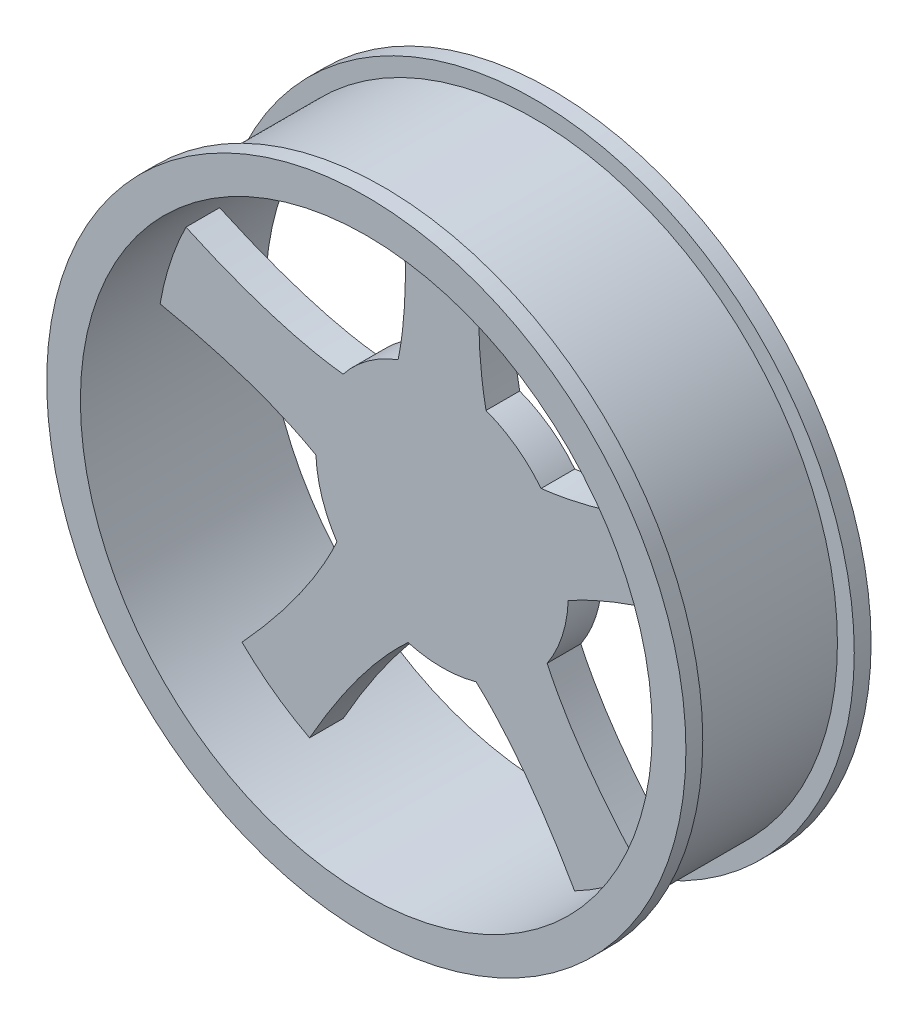
from build123d import *

# Parameters (mm, degrees)
BOSS_EXTRUDE1_DEPTH      = 2
BOSS_EXTRUDE1_DEPTH_BACK = 2
SKETCH3_R                = 15
BOSS_EXTRUDE3_DEPTH      = 2
BOSS_EXTRUDE3_DEPTH_BACK = 2


with BuildPart() as part:
    # Sketch2 → Revolve1 (revolve)
    with BuildSketch(Plane(origin=(0, 0, 0), x_dir=(0, 0, -1), z_dir=(1, 0, 0))):
        Polygon((-9, 35.970899576), (9, 35.970899576), (9, 37.970899576), (11, 37.970899576), (11, 33.970899576), (-11, 33.970899576), (-11, 37.970899576), (-9, 37.970899576), align=None)
    revolve(axis=Axis((0, 0, 10), (0, 0, -1)))



with BuildPart() as body_2:
    # Sketch3 → Boss-Extrude1 (new, two sides: drawn at the far end of the back side and taken through both)
    with BuildSketch(Plane.XY.offset(-BOSS_EXTRUDE1_DEPTH_BACK)):
        Circle(SKETCH3_R)
    extrude(amount=BOSS_EXTRUDE1_DEPTH + BOSS_EXTRUDE1_DEPTH_BACK)


with BuildPart() as part_1:
    add(part.part)

    add(body_2.part)  # Boss-Extrude3 merges body 2
    # Sketch11 → Boss-Extrude3 (add, two sides: drawn at the far end of the back side and taken through both)
    with BuildSketch(Plane.XY.offset(-BOSS_EXTRUDE3_DEPTH_BACK)):
        with BuildLine():
            Line((5, 33.970899576), (-5, 33.970899576))
            add(Edge.make_bspline(
                [(-5, 33.970899576), (-3.602966052, 22.002598894), (-5.219370498, 14.062651656)],
                knots=[0, 0, 0, 0.277878322, 0.277878322, 0.277878322], degree=2))
            add(Edge.make_bspline(
                [(-5.219370498, 14.062651656), (-3.623415853, 14.571458155), (-2.092021841, 14.791258924)],
                knots=[0, 0, 0, 0.220994238, 0.220994238, 0.220994238], degree=2))
            add(Edge.make_bspline(
                [(-2.092021841, 14.791258924), (0.275566205, 15.158843416), (2.712697031, 14.915974307), (5.219370636, 14.062651605)],
                knots=[0.31222072, 0.31222072, 0.31222072, 0.31222072, 0.753229942, 0.753229942, 0.753229942, 0.753229942], degree=3))
            add(Edge.make_bspline(
                [(5, 33.970899576), (3.602966194, 22.002598839), (5.219370636, 14.062651605)],
                knots=[0, 0, 0, 0.277878321, 0.277878321, 0.277878321], degree=2))
        make_face()
        with BuildLine():
            Line((33.853330378, 5.742302702), (30.763160434, 15.252867865))
            add(Edge.make_bspline(
                [(30.763160434, 15.252867865), (19.812337313, 10.225801321), (11.76150231, 9.309514671)],
                knots=[0, 0, 0, 0.277878322, 0.277878322, 0.277878322], degree=2))
            add(Edge.make_bspline(
                [(11.76150231, 9.309514671), (12.738583154, 7.948901461), (13.420852883, 6.56038138)],
                knots=[0, 0, 0, 0.220994238, 0.220994238, 0.220994238], degree=2))
            add(Edge.make_bspline(
                [(13.420852883, 6.56038138), (14.50207145, 4.422261196), (15.024204045, 2.029361361), (14.987250672, -0.618318123)],
                knots=[0.31222072, 0.31222072, 0.31222072, 0.31222072, 0.753229942, 0.753229942, 0.753229942, 0.753229942], degree=3))
            add(Edge.make_bspline(
                [(33.853330378, 5.742302702), (22.039092786, 3.372552484), (14.987250672, -0.618318123)],
                knots=[0, 0, 0, 0.277878321, 0.277878321, 0.277878321], degree=2))
        make_face()
        with BuildLine():
            Line((15.922508806, -30.421961333), (24.01267875, -24.54410881))
            add(Edge.make_bspline(
                [(24.01267875, -24.54410881), (15.847663908, -15.682706115), (12.488378684, -8.309055171)],
                knots=[0, 0, 0, 0.277878322, 0.277878322, 0.277878322], degree=2))
            add(Edge.make_bspline(
                [(12.488378684, -8.309055171), (11.496293211, -9.658766879), (10.386565081, -10.736720252)],
                knots=[0, 0, 0, 0.220994238, 0.220994238, 0.220994238], degree=2))
            add(Edge.make_bspline(
                [(10.386565081, -10.736720252), (8.687206859, -12.42573569), (6.572771723, -13.661760011), (4.043259677, -14.444793221)],
                knots=[0.31222072, 0.31222072, 0.31222072, 0.31222072, 0.753229942, 0.753229942, 0.753229942, 0.753229942], degree=3))
            add(Edge.make_bspline(
                [(15.922508806, -30.421961333), (10.017942228, -19.918246775), (4.043259677, -14.444793221)],
                knots=[0, 0, 0, 0.277878321, 0.277878321, 0.277878321], degree=2))
        make_face()
        with BuildLine():
            Line((-24.01267875, -24.54410881), (-15.922508806, -30.421961333))
            add(Edge.make_bspline(
                [(-15.922508806, -30.421961333), (-10.017942375, -19.918246736), (-4.043259819, -14.444793181)],
                knots=[0, 0, 0, 0.277878322, 0.277878322, 0.277878322], degree=2))
            add(Edge.make_bspline(
                [(-4.043259819, -14.444793181), (-5.633483205, -13.918347682), (-7.001602636, -13.196039424)],
                knots=[0, 0, 0, 0.220994238, 0.220994238, 0.220994238], degree=2))
            add(Edge.make_bspline(
                [(-7.001602636, -13.196039424), (-9.133082344, -12.101788187), (-10.96200772, -10.472793393), (-12.488378766, -8.309055048)],
                knots=[0.31222072, 0.31222072, 0.31222072, 0.31222072, 0.753229942, 0.753229942, 0.753229942, 0.753229942], degree=3))
            add(Edge.make_bspline(
                [(-24.01267875, -24.54410881), (-15.847663991, -15.682705988), (-12.488378766, -8.309055048)],
                knots=[0, 0, 0, 0.277878321, 0.277878321, 0.277878321], degree=2))
        make_face()
        with BuildLine():
            Line((-30.763160434, 15.252867865), (-33.853330378, 5.742302702))
            add(Edge.make_bspline(
                [(-33.853330378, 5.742302702), (-22.039092794, 3.372552636), (-14.987250678, -0.618317975)],
                knots=[0, 0, 0, 0.277878322, 0.277878322, 0.277878322], degree=2))
            add(Edge.make_bspline(
                [(-14.987250678, -0.618317975), (-14.977977306, 1.056754944), (-14.713793486, 2.581119372)],
                knots=[0, 0, 0, 0.220994238, 0.220994238, 0.220994238], degree=2))
            add(Edge.make_bspline(
                [(-14.713793486, 2.581119372), (-14.33176217, 4.946419265), (-13.347665078, 7.189217736), (-11.761502219, 9.309514786)],
                knots=[0.31222072, 0.31222072, 0.31222072, 0.31222072, 0.753229942, 0.753229942, 0.753229942, 0.753229942], degree=3))
            add(Edge.make_bspline(
                [(-30.763160434, 15.252867865), (-19.812337217, 10.225801439), (-11.761502219, 9.309514786)],
                knots=[0, 0, 0, 0.277878321, 0.277878321, 0.277878321], degree=2))
        make_face()
    extrude(amount=BOSS_EXTRUDE3_DEPTH + BOSS_EXTRUDE3_DEPTH_BACK)


solid = part_1.part
